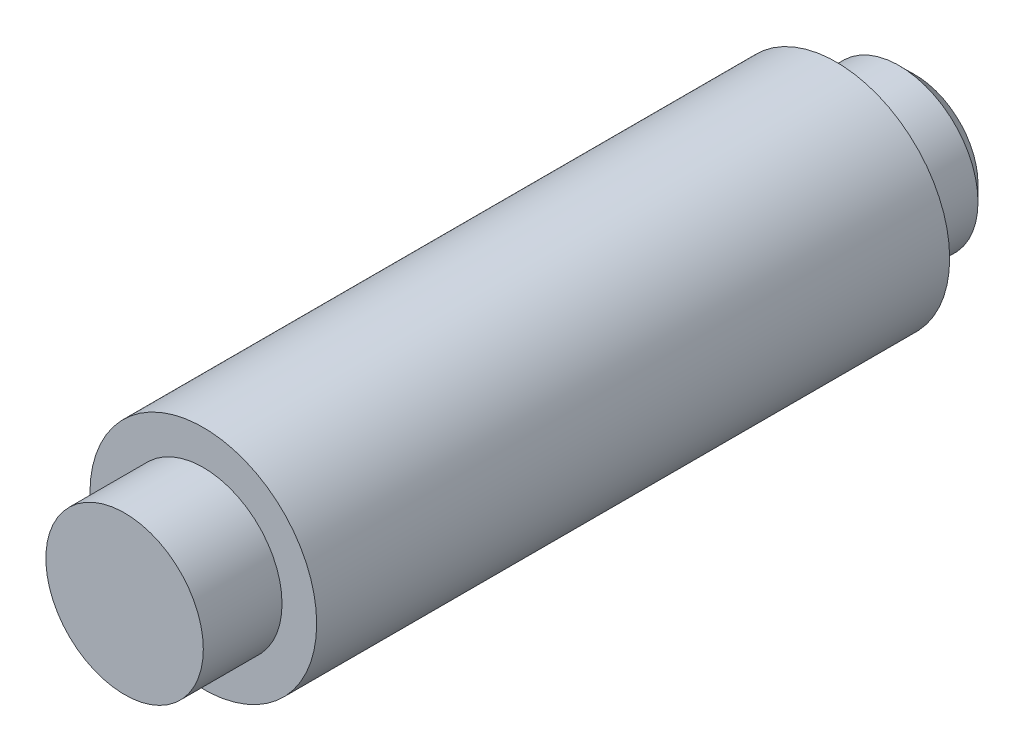
from build123d import *

# Parameters (mm, degrees)
SKETCH3_R           = 3.6
BOSS_EXTRUDE1_DEPTH = 20.1
SKETCH4_R           = 2.5
BOSS_EXTRUDE2_DEPTH = 2.5
BOSS_EXTRUDE3_START = 2.5
SKETCH5_R           = 2.5
BOSS_EXTRUDE3_DEPTH = 2.5
CHAMFER1_SIZE       = 0.5


with BuildPart() as part:
    # Sketch3 → Boss-Extrude1 (new body)
    with BuildSketch(Plane.XY):
        Circle(SKETCH3_R)
    extrude(amount=BOSS_EXTRUDE1_DEPTH)

    # Sketch4 → Boss-Extrude2 (add)
    with BuildSketch(Plane.XY):
        Circle(SKETCH4_R)
    extrude(amount=-BOSS_EXTRUDE2_DEPTH)

    # Sketch5 → Boss-Extrude3 (add)
    with BuildSketch(Plane.XY.offset(20.1).offset(BOSS_EXTRUDE3_START)):
        Circle(SKETCH5_R)
    extrude(amount=-BOSS_EXTRUDE3_DEPTH)

    # Chamfer1
    chamfer1_edges = [part.edges().sort_by_distance(p)[0] for p in [
        (-2.5, 0, -2.5),
    ]]
    chamfer(chamfer1_edges, length=CHAMFER1_SIZE)


solid = part.part
